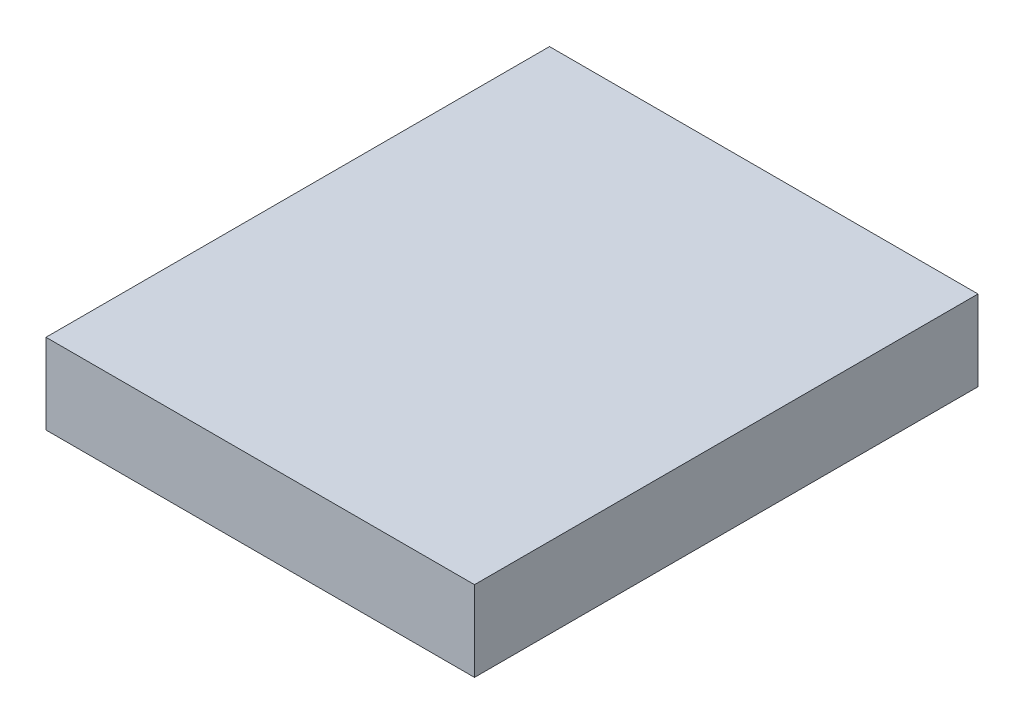
from build123d import *

# Parameters (mm, degrees)
SKETCH2_W           = 50.8
SKETCH2_H           = 59.69
BOSS_EXTRUDE1_DEPTH = 9.525


with BuildPart() as part:
    # Sketch2 → Boss-Extrude1 (new body)
    with BuildSketch(Plane(origin=(0, 0, 0), x_dir=(1, 0, 0), z_dir=(0, 1, 0))):
        Rectangle(SKETCH2_W, SKETCH2_H)
    extrude(amount=BOSS_EXTRUDE1_DEPTH)


solid = part.part
